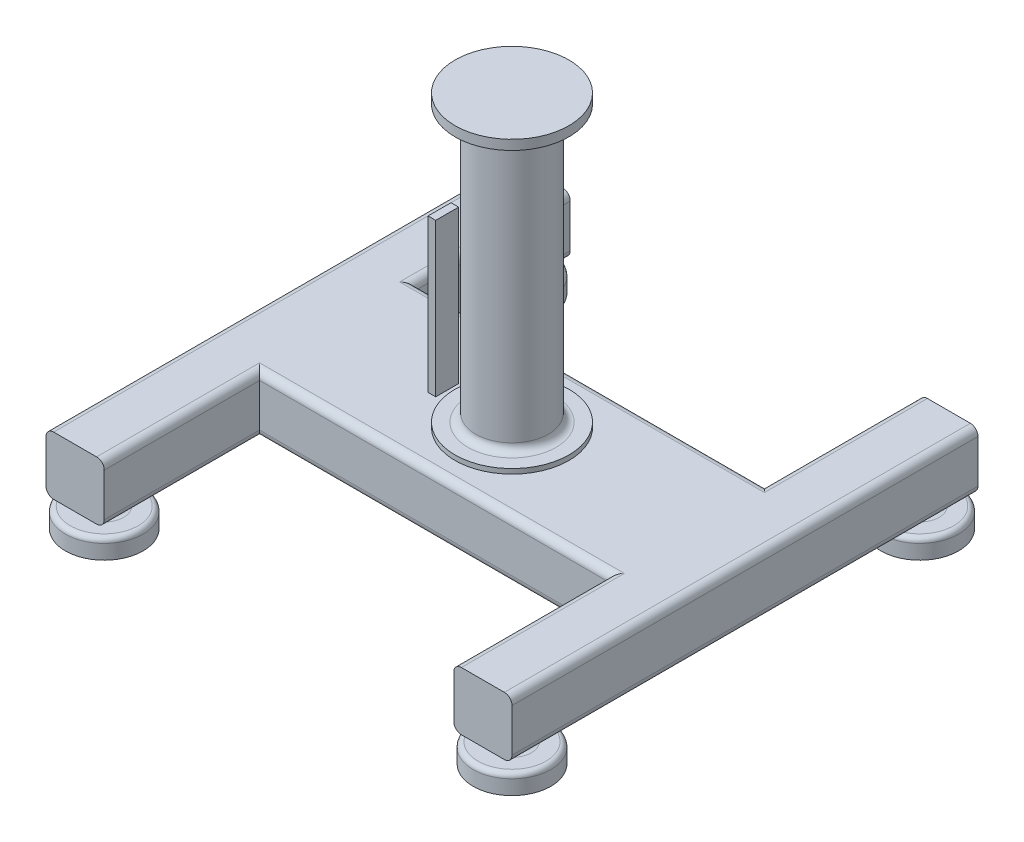
from build123d import *

# Parameters (mm, degrees)
SKETCH1_W           = 609.6
SKETCH1_H           = 609.6
BOSS_EXTRUDE1_DEPTH = 76.2
SKETCH2_W           = 457.2
SKETCH2_H           = 203.2
CUT_EXTRUDE1_DEPTH  = 438.735673666
FILLET1_R           = 10
SKETCH4_R           = 12.7
BOSS_EXTRUDE2_DEPTH = 12.7
SKETCH5_R           = 50.8
BOSS_EXTRUDE3_DEPTH = 25.4
FILLET3_R           = 12.7
FILLET4_R           = 6.35
SKETCH6_R           = 74.5
BOSS_EXTRUDE4_DEPTH = 6.35
SKETCH7_R           = 47.5
BOSS_EXTRUDE5_DEPTH = 360.3
SKETCH8_R           = 74.5
BOSS_EXTRUDE6_DEPTH = 12.7
FILLET5_R           = 10
SKETCH9_W           = 10
SKETCH9_H           = 30
BOSS_EXTRUDE7_DEPTH = 200


with BuildPart() as part:
    # Sketch1 → Boss-Extrude1 (new body)
    with BuildSketch(Plane(origin=(0, 0, 0), x_dir=(1, 0, 0), z_dir=(0, 1, 0))):
        Rectangle(SKETCH1_W, SKETCH1_H)
    extrude(amount=BOSS_EXTRUDE1_DEPTH)

    # Sketch2 → Cut-Extrude1 (cut, through all)
    with BuildSketch(Plane(origin=(0, 76.2, 0), x_dir=(1, 0, 0), z_dir=(0, 1, 0))):
        with Locations((0, -203.2)):
            Rectangle(SKETCH2_W, SKETCH2_H)
        with Locations((0, 203.2)):
            Rectangle(SKETCH2_W, SKETCH2_H)
    extrude(amount=-CUT_EXTRUDE1_DEPTH, mode=Mode.SUBTRACT)

    # Fillet1
    fillet1_edges = [part.edges().sort_by_distance(p)[0] for p in [
        (304.8, 76.2, 0),
        (-228.6, 0, 203.2),
        (0, 0, 101.6),
        (228.6, 0, 203.2),
        (228.6, 76.2, 203.2),
        (0, 76.2, 101.6),
        (-228.6, 76.2, 203.2),
        (0, 0, -101.6),
        (-228.6, 0, -203.2),
        (228.6, 0, -203.2),
        (0, 76.2, -101.6),
        (228.6, 76.2, -203.2),
        (-228.6, 76.2, -203.2),
        (-304.8, 76.2, 0),
        (304.8, 0, 0),
        (-304.8, 0, 0),
    ]]
    fillet(fillet1_edges, radius=FILLET1_R)

    # Sketch4 → Boss-Extrude2 (add)
    with BuildSketch(Plane.XZ):
        with Locations(Location((-266.7, 266.7, 0), (0, 0, 270))):
            Circle(SKETCH4_R)
        with Locations(Location((266.7, 266.7, 0), (0, 0, 270))):
            Circle(SKETCH4_R)
        with Locations(Location((266.7, -266.7, 0), (0, 0, 270))):
            Circle(SKETCH4_R)
        with Locations(Location((-266.7, -266.7, 0), (0, 0, 270))):
            Circle(SKETCH4_R)
    extrude(amount=BOSS_EXTRUDE2_DEPTH)

    # Sketch5 → Boss-Extrude3 (add)
    with BuildSketch(Plane.XZ.offset(12.7)):
        with Locations(Location((-266.7, 266.7, 0), (0, 0, 270))):
            Circle(SKETCH5_R)
        with Locations(Location((266.7, 266.7, 0), (0, 0, 270))):
            Circle(SKETCH5_R)
        with Locations(Location((266.7, -266.7, 0), (0, 0, 270))):
            Circle(SKETCH5_R)
        with Locations(Location((-266.7, -266.7, 0), (0, 0, 270))):
            Circle(SKETCH5_R)
    extrude(amount=BOSS_EXTRUDE3_DEPTH)

    # Fillet3
    fillet3_edges = [part.edges().sort_by_distance(p)[0] for p in [
        (-266.7, -12.7, 279.4),
        (266.7, -12.7, 279.4),
        (266.7, -12.7, -254),
        (-266.7, -12.7, -254),
    ]]
    fillet(fillet3_edges, radius=FILLET3_R - 0.0001)  # a hair under: the kernel refuses the full size

    # Fillet4
    fillet4_edges = [part.edges().sort_by_distance(p)[0] for p in [
        (-266.7, -12.7, 317.5),
        (266.7, -12.7, 317.5),
        (266.7, -12.7, -215.9),
        (-266.7, -12.7, -215.9),
    ]]
    fillet(fillet4_edges, radius=FILLET4_R)

    # Sketch6 → Boss-Extrude4 (add)
    with BuildSketch(Plane(origin=(0, 76.2, 0), x_dir=(1, 0, 0), z_dir=(0, 1, 0))):
        with Locations(Location((0, 0, 0), (0, 0, 90))):
            Circle(SKETCH6_R)
    extrude(amount=BOSS_EXTRUDE4_DEPTH)

    # Sketch7 → Boss-Extrude5 (add)
    with BuildSketch(Plane(origin=(0, 82.55, 0), x_dir=(1, 0, 0), z_dir=(0, 1, 0))):
        with Locations(Location((0, 0, 0), (0, 0, 90))):
            Circle(SKETCH7_R)
    extrude(amount=BOSS_EXTRUDE5_DEPTH)

    # Sketch8 → Boss-Extrude6 (add)
    with BuildSketch(Plane(origin=(0, 442.85, 0), x_dir=(1, 0, 0), z_dir=(0, 1, 0))):
        with Locations(Location((0, 0, 0), (0, 0, 90))):
            Circle(SKETCH8_R)
    extrude(amount=BOSS_EXTRUDE6_DEPTH)

    # Fillet5
    fillet5_edges = [part.edges().sort_by_distance(p)[0] for p in [
        (0, 82.55, 47.5),
        (0, 442.85, 47.5),
    ]]
    fillet(fillet5_edges, radius=FILLET5_R)

    # Sketch9 → Boss-Extrude7 (add)
    with BuildSketch(Plane(origin=(0, 76.2, 0), x_dir=(1, 0, 0), z_dir=(0, 1, 0))):
        with Locations((-89.8, 0)):
            Rectangle(SKETCH9_W, SKETCH9_H)
    extrude(amount=BOSS_EXTRUDE7_DEPTH)


solid = part.part
